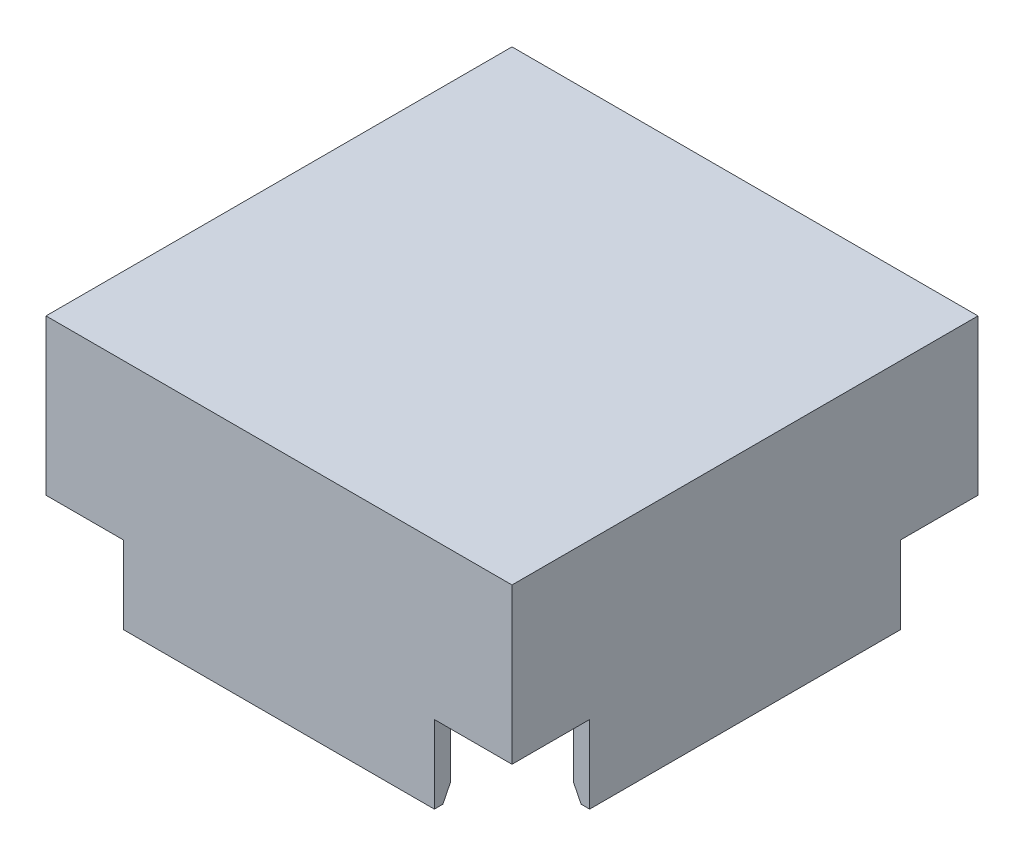
from build123d import *
from OCP.BRepFilletAPI import BRepFilletAPI_MakeChamfer

# Parameters (mm, degrees)
SKETCH1_W           = 76.2
SKETCH1_H           = 76.2
BOSS_EXTRUDE1_DEPTH = 25.4
SKETCH2_W           = 57.15
SKETCH2_H           = 57.15
CUT_EXTRUDE1_DEPTH  = 19.05
SKETCH3_W           = 2.667
SKETCH3_H           = 50.8
SKETCH3_W_2         = 50.8
SKETCH3_H_2         = 2.667
BOSS_EXTRUDE2_DEPTH = 12.7
CHAMFER1_SIZE       = 2.54
CHAMFER1_SIZE2      = 1.27


with BuildPart() as part:
    # Sketch1 → Boss-Extrude1 (new body)
    with BuildSketch(Plane(origin=(0, 1478.617106037, 0), x_dir=(1, 0, 0), z_dir=(0, 1, 0))):
        with Locations((-492.049198231, -806.92955637)):
            Rectangle(SKETCH1_W, SKETCH1_H)
    extrude(amount=BOSS_EXTRUDE1_DEPTH)

    # Sketch2 → Cut-Extrude1 (cut)
    with BuildSketch(Plane(origin=(0, 1478.617106037, 0), x_dir=(-1, 0, 0), z_dir=(0, -1, 0))):
        with Locations((492.049198231, -806.92955637)):
            Rectangle(SKETCH2_W, SKETCH2_H)
    extrude(amount=-CUT_EXTRUDE1_DEPTH, mode=Mode.SUBTRACT)

    # Sketch3 → Boss-Extrude2 (add)
    with BuildSketch(Plane(origin=(0, 1478.617106037, 0), x_dir=(-1, 0, 0), z_dir=(0, -1, 0))):
        with Locations((528.815698231, -806.92955637)):
            Rectangle(SKETCH3_W, SKETCH3_H)
        with Locations((492.049198231, -770.16305637)):
            Rectangle(SKETCH3_W_2, SKETCH3_H_2)
        with Locations((492.049198231, -843.69605637)):
            Rectangle(SKETCH3_W_2, SKETCH3_H_2)
        with Locations((455.282698231, -806.92955637)):
            Rectangle(SKETCH3_W, SKETCH3_H)
    extrude(amount=BOSS_EXTRUDE2_DEPTH)

    # Chamfer1: one chamfer whose edges measure the first distance from different faces: ONE call of the kernel's chamfer builder (chamfer() names one face for all edges)
    chamfer1_edges_1 = [part.edges().sort_by_distance(p)[0] for p in [
        (-492.049198231, 1465.917106037, 842.36255637),
    ]]
    chamfer1_side_1 = [part.faces().sort_by_distance(p)[0] for p in [
        (-492.049198231, 1472.267106037, 842.36255637),
    ]]
    chamfer1_edges_2 = [part.edges().sort_by_distance(p)[0] for p in [
        (-527.482198231, 1465.917106037, 806.92955637),
    ]]
    chamfer1_side_2 = [part.faces().sort_by_distance(p)[0] for p in [
        (-527.482198231, 1472.267106037, 806.92955637),
    ]]
    chamfer1_edges_3 = [part.edges().sort_by_distance(p)[0] for p in [
        (-456.616198231, 1465.917106037, 806.92955637),
    ]]
    chamfer1_side_3 = [part.faces().sort_by_distance(p)[0] for p in [
        (-456.616198231, 1472.267106037, 806.92955637),
    ]]
    chamfer1_edges_4 = [part.edges().sort_by_distance(p)[0] for p in [
        (-492.049198231, 1465.917106037, 771.49655637),
    ]]
    chamfer1_side_4 = [part.faces().sort_by_distance(p)[0] for p in [
        (-492.049198231, 1472.267106037, 771.49655637),
    ]]
    chamfer1 = BRepFilletAPI_MakeChamfer(part.part.solid().wrapped)
    for e in chamfer1_edges_1:
        chamfer1.Add(CHAMFER1_SIZE, CHAMFER1_SIZE2, e.wrapped, chamfer1_side_1[0].wrapped)  # the first distance lies on this face
    for e in chamfer1_edges_2:
        chamfer1.Add(CHAMFER1_SIZE, CHAMFER1_SIZE2, e.wrapped, chamfer1_side_2[0].wrapped)  # the first distance lies on this face
    for e in chamfer1_edges_3:
        chamfer1.Add(CHAMFER1_SIZE, CHAMFER1_SIZE2, e.wrapped, chamfer1_side_3[0].wrapped)  # the first distance lies on this face
    for e in chamfer1_edges_4:
        chamfer1.Add(CHAMFER1_SIZE, CHAMFER1_SIZE2, e.wrapped, chamfer1_side_4[0].wrapped)  # the first distance lies on this face
    add(Compound.cast(chamfer1.Shape()), mode=Mode.REPLACE)


solid = part.part
